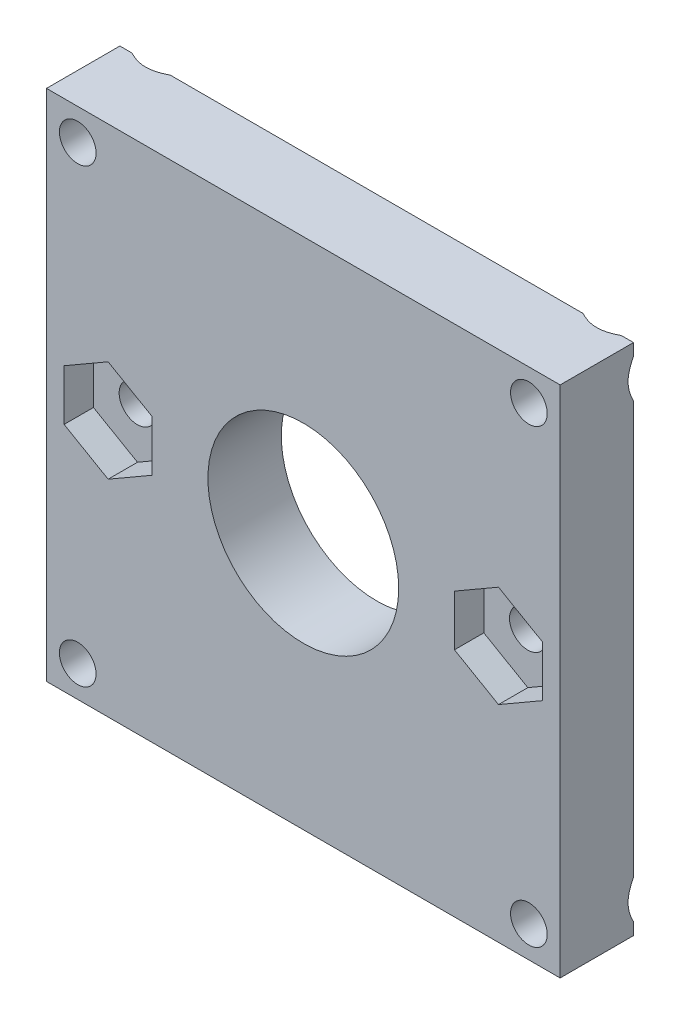
from build123d import *

# Parameters (mm, degrees)
CROQUIS1_W              = 35
CROQUIS1_H              = 35
CROQUIS1_R              = 1.25
CROQUIS1_R_2            = 6.5
SALIENTE_EXTRUIR1_DEPTH = 5
CORTAR_EXTRUIR1_DEPTH   = 2
CHAFL_N1_SIZE           = 1.25


with BuildPart() as part:
    # Croquis1 → Saliente-Extruir1 (new body)
    with BuildSketch(Plane.XY):
        Rectangle(CROQUIS1_W, CROQUIS1_H)
        with Locations((-15.37, 15.37)):
            Circle(CROQUIS1_R, mode=Mode.SUBTRACT)
        with Locations((15.37, 15.37)):
            Circle(CROQUIS1_R, mode=Mode.SUBTRACT)
        with Locations((15.37, -15.37)):
            Circle(CROQUIS1_R, mode=Mode.SUBTRACT)
        with Locations((-15.37, -15.37)):
            Circle(CROQUIS1_R, mode=Mode.SUBTRACT)
        Circle(CROQUIS1_R_2, mode=Mode.SUBTRACT)
        with Locations((13.3, 0)):
            Circle(CROQUIS1_R, mode=Mode.SUBTRACT)
        with Locations((-13.3, 0)):
            Circle(CROQUIS1_R, mode=Mode.SUBTRACT)
    extrude(amount=SALIENTE_EXTRUIR1_DEPTH)

    # Croquis2 → Cortar-Extruir1 (cut)
    with BuildSketch(Plane.XY.offset(5)):
        Polygon((-13.3, 3.464101615), (-16.3, 1.732050808), (-16.3, -1.732050808), (-13.3, -3.464101615), (-10.3, -1.732050808), (-10.3, 1.732050808), align=None)
        Polygon((13.3, 3.464101615), (10.3, 1.732050808), (10.3, -1.732050808), (13.3, -3.464101615), (16.3, -1.732050808), (16.3, 1.732050808), align=None)
    extrude(amount=-CORTAR_EXTRUIR1_DEPTH, mode=Mode.SUBTRACT)

    # Chaflán1
    # the kernel refuses this chamfer: 1.25 mm, written as the material it takes off along each edge
    with BuildSketch(Plane(origin=(-15.37, 15.37, 0), x_dir=(1, 0, 0), z_dir=(0, -1, 0))) as chafl_n1_piece_1:
        Polygon((1.25 + CHAFL_N1_SIZE, 0), (1.25, CHAFL_N1_SIZE), (1.25, 0), align=None)
    revolve(axis=Axis((-15.37, 15.37, 0), (0, 0, 1)), mode=Mode.SUBTRACT)
    with BuildSketch(Plane(origin=(15.37, 15.37, 0), x_dir=(1, 0, 0), z_dir=(0, -1, 0))) as chafl_n1_piece_2:
        Polygon((1.25 + CHAFL_N1_SIZE, 0), (1.25, CHAFL_N1_SIZE), (1.25, 0), align=None)
    revolve(axis=Axis((15.37, 15.37, 0), (0, 0, 1)), mode=Mode.SUBTRACT)
    with BuildSketch(Plane(origin=(15.37, -15.37, 0), x_dir=(1, 0, 0), z_dir=(0, -1, 0))) as chafl_n1_piece_3:
        Polygon((1.25 + CHAFL_N1_SIZE, 0), (1.25, CHAFL_N1_SIZE), (1.25, 0), align=None)
    revolve(axis=Axis((15.37, -15.37, 0), (0, 0, 1)), mode=Mode.SUBTRACT)
    with BuildSketch(Plane(origin=(-15.37, -15.37, 0), x_dir=(1, 0, 0), z_dir=(0, -1, 0))) as chafl_n1_piece_4:
        Polygon((1.25 + CHAFL_N1_SIZE, 0), (1.25, CHAFL_N1_SIZE), (1.25, 0), align=None)
    revolve(axis=Axis((-15.37, -15.37, 0), (0, 0, 1)), mode=Mode.SUBTRACT)


solid = part.part
